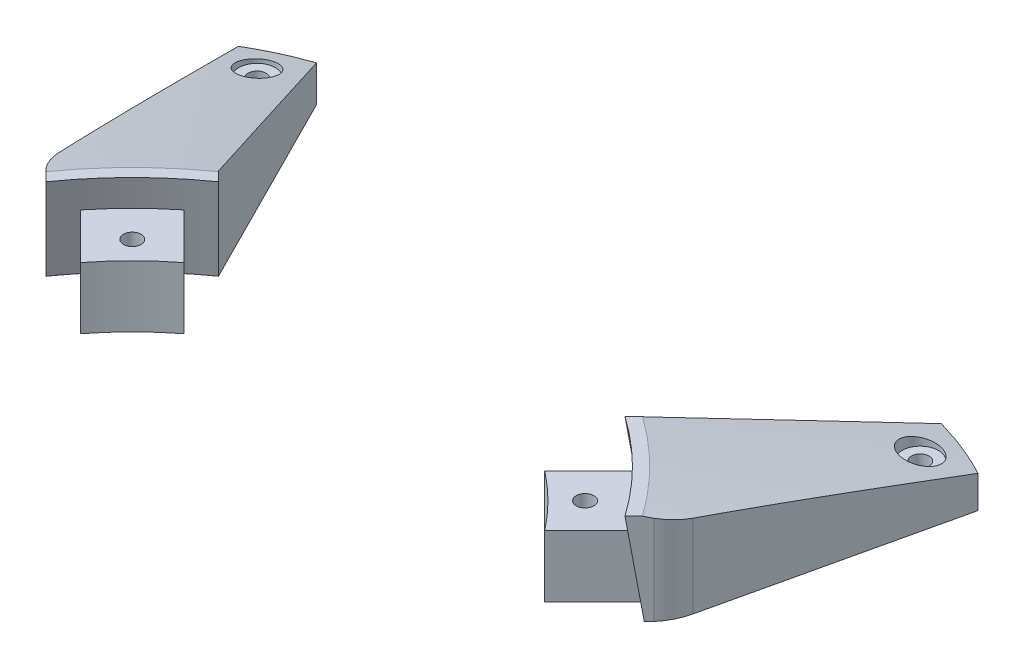
from build123d import *

# Parameters (mm, degrees)
SALIENTE_EXTRUIR1_START = -36.400588291
SALIENTE_EXTRUIR1_DEPTH = 10.1
SALIENTE_EXTRUIR2_REACH = 99.517
SALIENTE_EXTRUIR2_START = -2.5
CROQUIS2_W              = 20
CROQUIS2_H              = 15
SALIENTE_EXTRUIR3_START = -15
SALIENTE_EXTRUIR3_DEPTH = 15
CORTAR_EXTRUIR1_START   = -5.5
CROQUIS5_R              = 3
CORTAR_EXTRUIR1_DEPTH   = 5
CROQUIS7_R              = 1.45
CORTAR_EXTRUIR2_DEPTH   = 10
CROQUIS8_R              = 1.45
CORTAR_EXTRUIR3_DEPTH   = 12
CROQUIS9_R              = 3
CORTAR_EXTRUIR4_DEPTH   = 3


# Read off the part's stored shape, not the designer's step: Saliente-Extruir1, Saliente-Extruir3
with BuildPart() as part:
    # Saliente-Extruir1 outline → Saliente-Extruir1 (new body)
    with BuildSketch(Plane(origin=(0, 0, 0), x_dir=(1, 0, 0), z_dir=(0, 1, 0)).offset(SALIENTE_EXTRUIR1_START)):
        with BuildLine():
            Line((22.502132111, -90.425189571), (33.23240821, -79.694913472))
            Line((33.23240821, -79.694913472), (24.747126835, -71.209632098))
            Line((24.747126835, -71.209632098), (14.016850737, -81.939908197))
            ThreePointArc((14.016850737, -81.939908197), (18.524587161, -85.917453147), (22.502132111, -90.425189571))
        make_face()
    extrude(amount=SALIENTE_EXTRUIR1_DEPTH)

    # Saliente-Extruir2: up to this cone (the profile starts outside it)
    saliente_extruir2_end = Plane(origin=(-15.557959692, -28.900588, 120), z_dir=(0, -1, 0)) * Cone(35.699767219, 82.498652467, 318.232419686, mode=Mode.PRIVATE)
    # Croquis2 → Saliente-Extruir2 (add, up to the surface)
    with BuildSketch(Plane(origin=(-23.231252631, 0, 23.231252631), x_dir=(-0.7071067811865487, 0, -0.7071067811865464), z_dir=(0.7071067811865464, 0, -0.7071067811865487)).offset(SALIENTE_EXTRUIR2_START), mode=Mode.PRIVATE) as saliente_extruir2_sk1:
        with Locations((-73.851674943, -28.900588291)):
            Rectangle(CROQUIS2_W, CROQUIS2_H)
    saliente_extruir2_tool1 = extrude(saliente_extruir2_sk1.sketch, amount=-SALIENTE_EXTRUIR2_REACH, mode=Mode.PRIVATE) - saliente_extruir2_end
    add(saliente_extruir2_tool1.solids().sort_by_distance((27.222001, -28.900588, 77.22004))[0])

    # Saliente-Extruir3 outline → Saliente-Extruir3 (add)
    with BuildSketch(Plane.XZ.offset(36.400588291).offset(SALIENTE_EXTRUIR3_START)):
        with BuildLine():
            ThreePointArc((35.675661183, 38.555225896), (40.483879833, 39.962158782), (45.07851977, 41.95908406))
            Line((45.07851977, 41.95908406), (36.39064162, 80.025775234))
            ThreePointArc((36.39064162, 80.025775234), (35.31648143, 82.774817587), (33.486624065, 85.090562823))
            ThreePointArc((33.486624065, 85.090562823), (27.009868535, 77.432171773), (19.351477485, 70.955416242))
            Line((19.351477485, 70.955416242), (19.352456623, 70.953472853))
            Line((19.352456623, 70.953472853), (35.675661183, 38.555225896))
        make_face()
    extrude(amount=SALIENTE_EXTRUIR3_DEPTH)

    # Croquis4 → Cortar-Revolución1 (revolve, cut)
    with BuildSketch(Plane(origin=(-15.557959692, -2.400588291, 120), x_dir=(0, 0, -1), z_dir=(1, 0, 0))):
        Polygon((60, -19), (100, -29), (100, -12.364078099), (60, -12.364078099), align=None)
    revolve(axis=Axis((-15.557959692, -2.400588291, 120), (0, -1, 0)), mode=Mode.SUBTRACT)

    # Croquis5 → Cortar-Extruir1 (cut)
    with BuildSketch(Plane.XZ.offset(36.400588291).offset(CORTAR_EXTRUIR1_START)):
        with Locations(Location((38.812176145, 45.16592802, 0), (0, 0, 270))):
            Circle(CROQUIS5_R)
    extrude(amount=-CORTAR_EXTRUIR1_DEPTH, mode=Mode.SUBTRACT)

    # Croquis7 → Cortar-Extruir2 (cut)
    with BuildSketch(Plane.XZ.offset(36.400588291)):
        with Locations(Location((38.812176145, 45.16592802, 0), (0, 0, 270))):
            Circle(CROQUIS7_R)
    extrude(amount=-CORTAR_EXTRUIR2_DEPTH, mode=Mode.SUBTRACT)

    # Croquis8 → Cortar-Extruir3 (cut)
    with BuildSketch(Plane(origin=(0, -26.300588291, 0), x_dir=(1, 0, 0), z_dir=(0, 1, 0))):
        with Locations(Location((21.56514632, -82.876893988, 0), (0, 0, 270))):
            Circle(CROQUIS8_R)
    extrude(amount=-CORTAR_EXTRUIR3_DEPTH, mode=Mode.SUBTRACT)

    # Croquis9 → Cortar-Extruir4 (cut)
    with BuildSketch(Plane.XZ.offset(36.400588291)):
        with Locations(Location((21.56514632, 82.876893988, 0), (0, 0, 270))):
            Circle(CROQUIS9_R)
    extrude(amount=-CORTAR_EXTRUIR4_DEPTH, mode=Mode.SUBTRACT)


with BuildPart() as body_2:
    # Simetría5: mirrored copy
    add(part.part.mirror(Plane(origin=(-15.557959692, -2.400588291, 120), x_dir=(0, 0, 1), z_dir=(1, 0, 0))))


solid = Compound([part.part, body_2.part])
